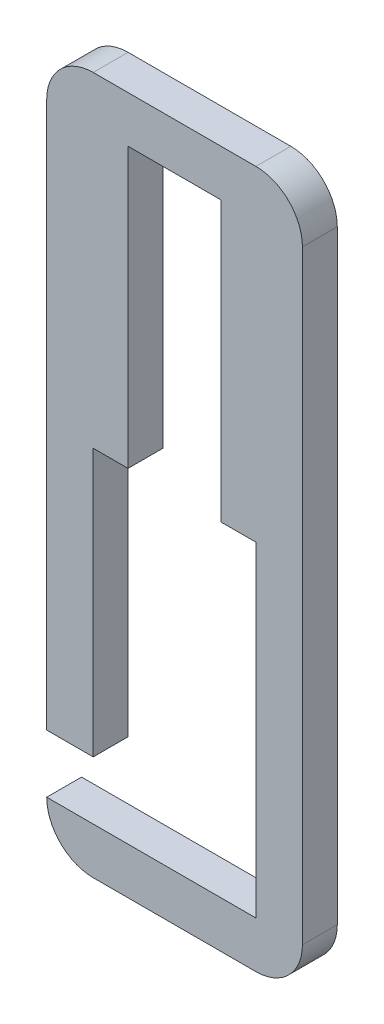
from build123d import *

# Parameters (mm, degrees)
SKETCH_1_W          = 22
SKETCH_1_H          = 60
EXTRUDE_2_DEPTH     = 3
SKETCH_2_W          = 4
SKETCH_2_H          = 5
CUT_EXTRUDE_1_DEPTH = 5
FILLET_1_R          = 4


with BuildPart() as part:
    # Эскиз1 → Бобышка-Вытянуть2 (new body)
    with BuildSketch(Plane.XY):
        Rectangle(SKETCH_1_W, SKETCH_1_H)
        Polygon((4, 26), (-4, 26), (-4, 2), (-7, 2), (-7, -26), (7, -26), (7, 2), (4, 2), align=None, mode=Mode.SUBTRACT)
    extrude(amount=EXTRUDE_2_DEPTH)

    # Эскиз2 → Вырез-Вытянуть1 (cut)
    with BuildSketch(Plane.XY.offset(3)):
        with Locations((-9, -23.5)):
            Rectangle(SKETCH_2_W, SKETCH_2_H)
    extrude(amount=-CUT_EXTRUDE_1_DEPTH, mode=Mode.SUBTRACT)

    # Скругление1
    fillet_1_edges = [part.edges().sort_by_distance(p)[0] for p in [
        (-11, 30, 1.5),
        (11, 30, 1.5),
        (11, -30, 1.5),
        (-11, -30, 1.5),
    ]]
    fillet(fillet_1_edges, radius=FILLET_1_R - 0.0001)  # a hair under: the kernel refuses the full size


solid = part.part
